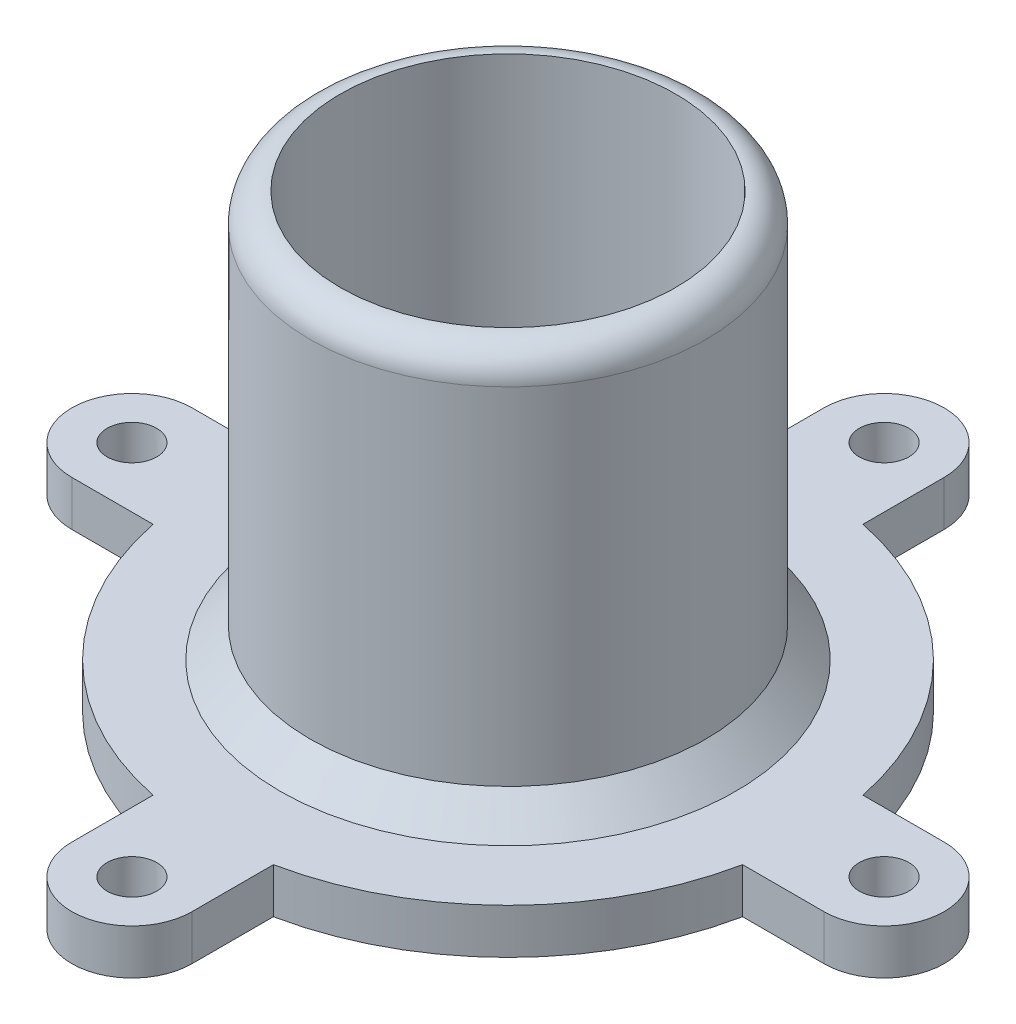
from build123d import *

# Parameters (mm, degrees)
CIRCUNFERENCES_R     = 20
CIRCUNFERENCES_R_2   = 13.15
EXT_DEPTH            = 3
CIRCUNFERENCES_3_R   = 13.15
CIRCUNFERENCES_3_R_2 = 11.15
CENT_DEPTH           = 30
ARM_START            = -3
ARMS_R               = 1.65
ARM_DEPTH            = 3
CIRPATTERN1_COUNT    = 4
CHAMFER1_SIZE        = 2
CHAMFER2_SIZE        = 2
FILLET1_R            = 2


with BuildPart() as part:
    # Circunferences → EXT (new body)
    with BuildSketch(Plane(origin=(0, 0, 0), x_dir=(1, 0, 0), z_dir=(0, 1, 0))):
        with Locations(Location((0, 0, 0), (0, 0, 270))):
            Circle(CIRCUNFERENCES_R)
        with Locations(Location((0, 0, 0), (0, 0, 270))):
            Circle(CIRCUNFERENCES_R_2, mode=Mode.SUBTRACT)
    extrude(amount=EXT_DEPTH)

    # Circunferences<3> → CENT (add)
    with BuildSketch(Plane(origin=(0, 0, 0), x_dir=(1, 0, 0), z_dir=(0, 1, 0))):
        with Locations(Location((0, 0, 0), (0, 0, 270))):
            Circle(CIRCUNFERENCES_3_R)
        with Locations(Location((0, 0, 0), (0, 0, 270))):
            Circle(CIRCUNFERENCES_3_R_2, mode=Mode.SUBTRACT)
    extrude(amount=CENT_DEPTH)

    # ARMS → ARM (add)
    with BuildSketch(Plane(origin=(0, 3, 0), x_dir=(1, 0, 0), z_dir=(0, 1, 0)).offset(ARM_START)):
        with BuildLine():
            Line((25, 4), (19.595917942, 4))
            ThreePointArc((19.595917942, 4), (19.89872306, 2.01017924), (20, 0))
            ThreePointArc((20, 0), (19.89872306, -2.01017924), (19.595917942, -4))
            Line((19.595917942, -4), (25, -4))
            ThreePointArc((25, -4), (29, 0), (25, 4))
        make_face()
        with Locations(Location((25, 0, 0), (0, 0, 270))):
            Circle(ARMS_R, mode=Mode.SUBTRACT)
    arm = extrude(amount=ARM_DEPTH)

    # CirPattern1: ARM ×4 about axis
    cirpattern1_axis = Axis((0, 0, 0), (0, 1, 0))
    for i in range(1, CIRPATTERN1_COUNT):
        add(arm.rotate(cirpattern1_axis, i * 360 / CIRPATTERN1_COUNT))

    # Chamfer1
    chamfer1_edges = [part.edges().sort_by_distance(p)[0] for p in [
        (0, 0, -11.15),
    ]]
    chamfer(chamfer1_edges, length=CHAMFER1_SIZE)

    # Chamfer2
    chamfer2_edges = [part.edges().sort_by_distance(p)[0] for p in [
        (0, 3, -13.15),
    ]]
    chamfer(chamfer2_edges, length=CHAMFER2_SIZE)

    # Fillet1
    fillet1_edges = [part.edges().sort_by_distance(p)[0] for p in [
        (0, 30, -13.15),
    ]]
    fillet(fillet1_edges, radius=FILLET1_R - 0.0001)  # a hair under: the kernel refuses the full size


solid = part.part
